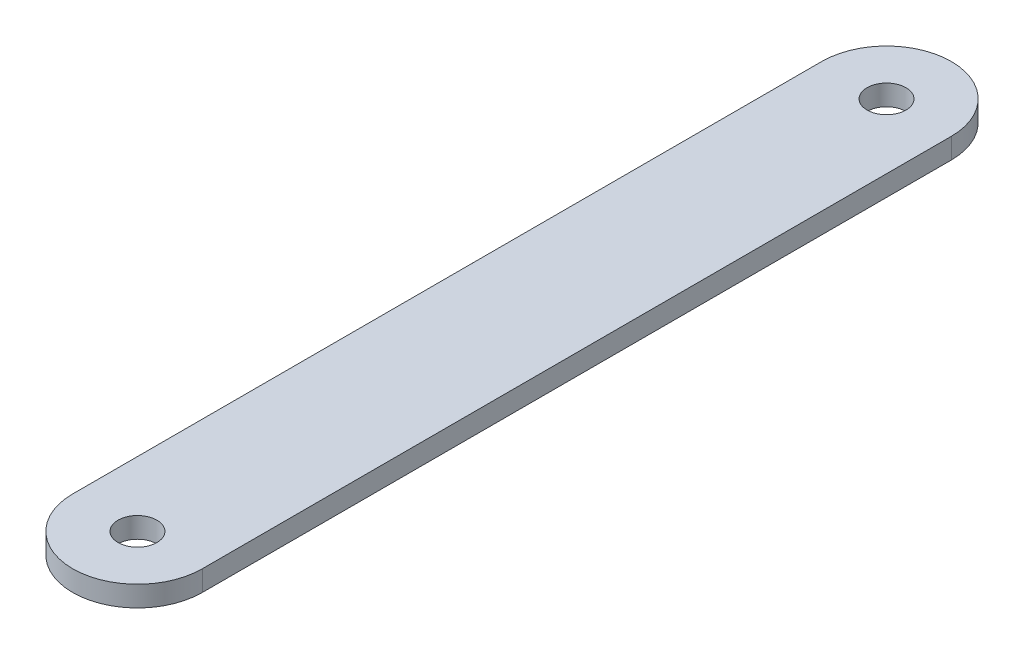
from build123d import *

# Parameters (mm, degrees)
SKETCH2_R           = 1.5
BOSS_EXTRUDE1_DEPTH = 1.5875


with BuildPart() as part:
    # Sketch2 → Boss-Extrude1 (new body)
    with BuildSketch(Plane(origin=(0, 0, 0), x_dir=(1, 0, 0), z_dir=(0, 1, 0))):
        with BuildLine():
            Line((-5, 57.8), (-5, 0))
            ThreePointArc((-5, 0), (0, -5), (5, 0))
            Line((5, 0), (5, 57.8))
            ThreePointArc((5, 57.8), (0, 62.8), (-5, 57.8))
        make_face()
        Circle(SKETCH2_R, mode=Mode.SUBTRACT)
        with Locations((0, 57.8)):
            Circle(SKETCH2_R, mode=Mode.SUBTRACT)
    extrude(amount=BOSS_EXTRUDE1_DEPTH)


solid = part.part
